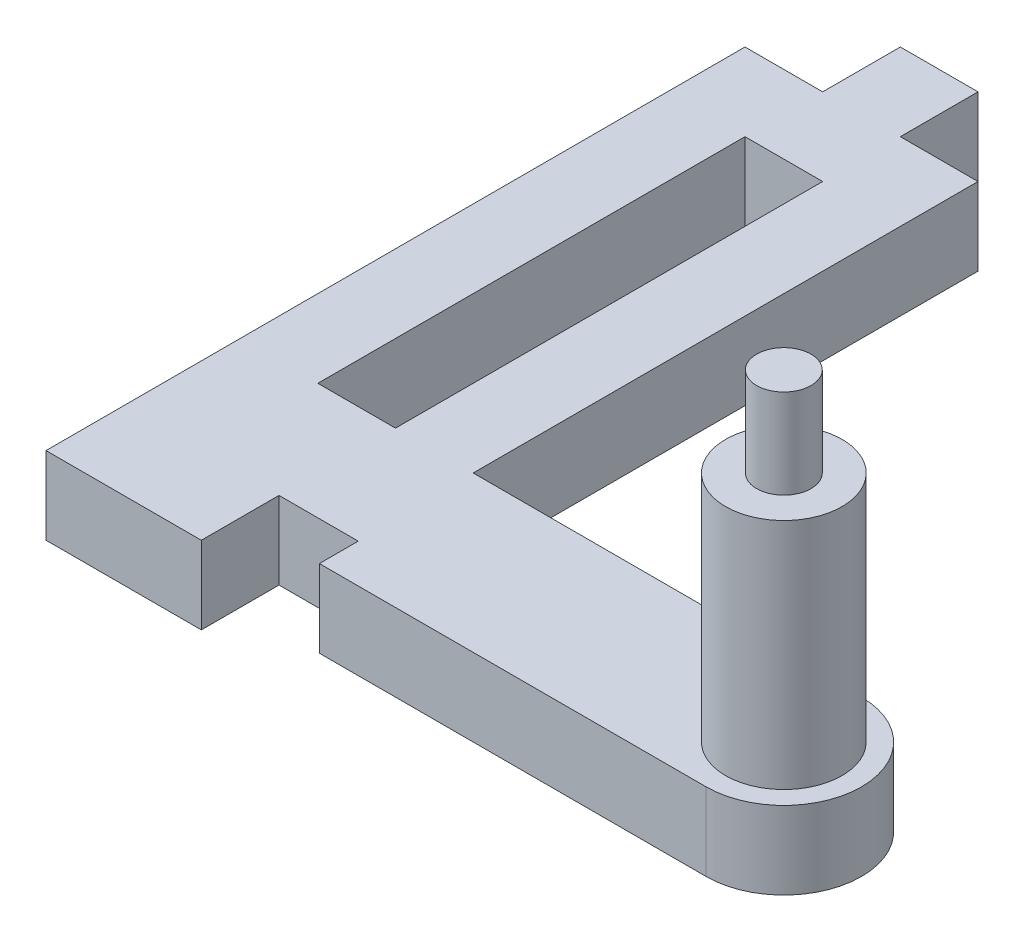
from build123d import *

# Parameters (mm, degrees)
SKETCH2_W           = 5
SKETCH2_H           = 27.5
BOSS_EXTRUDE1_DEPTH = 5
SKETCH3_R           = 3.75
BOSS_EXTRUDE2_DEPTH = 15
SKETCH4_R           = 1.75
BOSS_EXTRUDE3_DEPTH = 5.75


with BuildPart() as part:
    # Sketch2 → Boss-Extrude1 (new body)
    with BuildSketch(Plane(origin=(0, 0, 0), x_dir=(1, 0, 0), z_dir=(0, 1, 0))):
        with BuildLine():
            Line((10, 40), (10, 45))
            Line((10, 45), (5, 45))
            Line((5, 45), (5, 40))
            Line((5, 40), (0, 40))
            Line((0, 40), (0, -5))
            Line((0, -5), (10, -5))
            Line((10, -5), (10, 0))
            Line((10, 0), (15.1, 0))
            Line((15.1, 0), (15.1, -2.5))
            Line((15.1, -2.5), (40, -2.5))
            ThreePointArc((40, -2.5), (45, 2.5), (40, 7.5))
            Line((40, 7.5), (15, 7.5))
            Line((15, 7.5), (15, 21.207579156))
            Line((15, 21.207579156), (15, 40))
            Line((15, 40), (10, 40))
        make_face()
        with Locations((7.5, 21.25)):
            Rectangle(SKETCH2_W, SKETCH2_H, mode=Mode.SUBTRACT)
    extrude(amount=BOSS_EXTRUDE1_DEPTH)

    # Sketch3 → Boss-Extrude2 (add)
    with BuildSketch(Plane(origin=(0, 5, 0), x_dir=(1, 0, 0), z_dir=(0, 1, 0))):
        with Locations((40, 2.5)):
            Circle(SKETCH3_R)
    extrude(amount=BOSS_EXTRUDE2_DEPTH)

    # Sketch4 → Boss-Extrude3 (add)
    with BuildSketch(Plane(origin=(0, 20, 0), x_dir=(1, 0, 0), z_dir=(0, 1, 0))):
        with Locations((40, 2.5)):
            Circle(SKETCH4_R)
    extrude(amount=BOSS_EXTRUDE3_DEPTH)


solid = part.part
